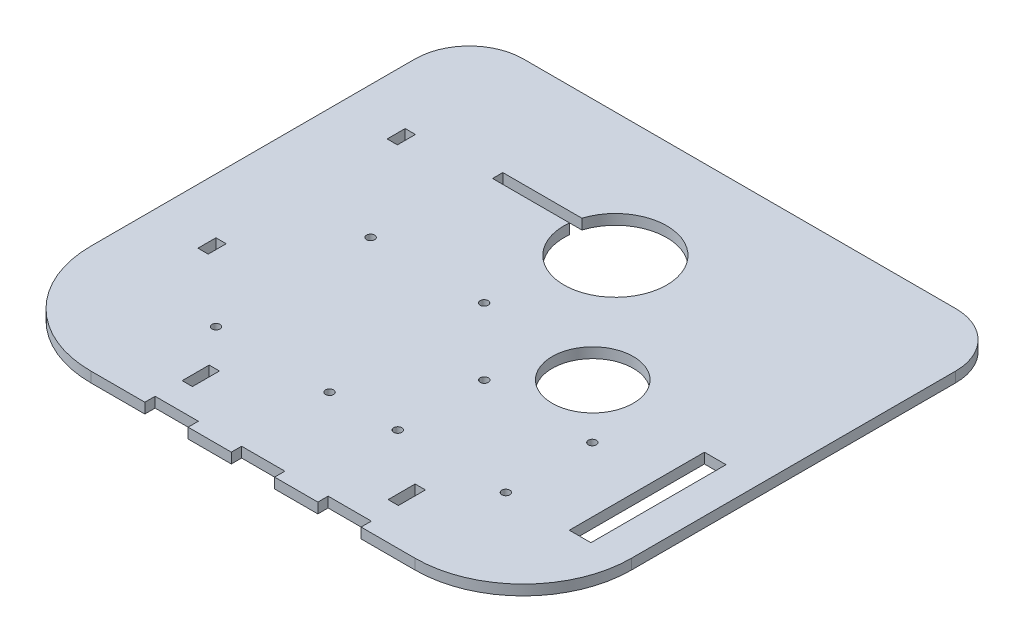
from build123d import *

# Parameters (mm, degrees)
SKETCH1_W           = 254
SKETCH1_H           = 228.6
BOSS_EXTRUDE1_DEPTH = 4.826
CUT_EXTRUDE3_DEPTH  = 4.826
SKETCH19_W          = 4.826
SKETCH19_H          = 8.466666666
CUT_EXTRUDE16_DEPTH = 171.929167423
FILLET11_R          = 50.8
SKETCH20_W          = 10.16
SKETCH20_H          = 63.5
CUT_EXTRUDE17_DEPTH = 171.929167423
SKETCH23_R          = 1.905
CUT_EXTRUDE18_DEPTH = 171.929167423
SKETCH24_W          = 20.32
SKETCH24_H          = 4.826
CUT_EXTRUDE19_DEPTH = 171.929167423
SKETCH26_R          = 24.13
CUT_EXTRUDE20_DEPTH = 171.929167423
SKETCH27_W          = 4.826
SKETCH27_H          = 12.7
CUT_EXTRUDE21_DEPTH = 171.929167423
SKETCH28_R          = 19.05
CUT_EXTRUDE22_DEPTH = 171.929167423
CUT_EXTRUDE23_DEPTH = 171.929167423


with BuildPart() as part:
    # Sketch1 → Boss-Extrude1 (new body)
    with BuildSketch(Plane(origin=(0, 0, 0), x_dir=(1, 0, 0), z_dir=(0, 1, 0))):
        Rectangle(SKETCH1_W, SKETCH1_H)
    extrude(amount=BOSS_EXTRUDE1_DEPTH)

    # Sketch4 → Cut-Extrude3 (cut)
    with BuildSketch(Plane(origin=(0, 4.826, 0), x_dir=(1, 0, 0), z_dir=(0, 1, 0))):
        with BuildLine():
            Line((-127, 88.9), (-127, 114.3))
            Line((-127, 114.3), (-101.6, 114.3))
            ThreePointArc((-101.6, 114.3), (-119.560512242, 106.860512242), (-127, 88.9))
        make_face()
        with BuildLine():
            Line((127, 88.9), (127, 114.3))
            Line((127, 114.3), (101.6, 114.3))
            ThreePointArc((101.6, 114.3), (119.560512242, 106.860512242), (127, 88.9))
        make_face()
    extrude(amount=-CUT_EXTRUDE3_DEPTH, mode=Mode.SUBTRACT)

    # Sketch19 → Cut-Extrude16 (cut, through all)
    with BuildSketch(Plane(origin=(0, 4.826, 0), x_dir=(1, 0, 0), z_dir=(0, 1, 0))):
        with Locations((-98.58699993, -34.925)):
            Rectangle(SKETCH19_W, SKETCH19_H)
        with Locations((-98.58699993, 53.975)):
            Rectangle(SKETCH19_W, SKETCH19_H)
    extrude(amount=-CUT_EXTRUDE16_DEPTH, mode=Mode.SUBTRACT)

    # Fillet11
    fillet11_edges = [part.edges().sort_by_distance(p)[0] for p in [
        (-127, 2.413, 114.3),
        (127, 2.413, 114.3),
    ]]
    fillet(fillet11_edges, radius=FILLET11_R)

    # Sketch20 → Cut-Extrude17 (cut, through all)
    with BuildSketch(Plane.XZ):
        with Locations((106.07999993, 34.925)):
            Rectangle(SKETCH20_W, SKETCH20_H)
    extrude(amount=-CUT_EXTRUDE17_DEPTH, mode=Mode.SUBTRACT)

    # Sketch23 → Cut-Extrude18 (cut, through all)
    with BuildSketch(Plane(origin=(0, 4.826, 0), x_dir=(1, 0, 0), z_dir=(0, 1, 0))):
        with Locations((70.741119647, -25.576370111)):
            Circle(SKETCH23_R)
        with Locations((70.741119647, -66.216370111)):
            Circle(SKETCH23_R)
        with Locations((19.941119647, -25.576370111)):
            Circle(SKETCH23_R)
        with Locations((19.941119647, -66.216370111)):
            Circle(SKETCH23_R)
        with Locations((-11.48044922, 5.792629889)):
            Circle(SKETCH23_R)
        with Locations((-64.82044922, 5.792629889)):
            Circle(SKETCH23_R)
        with Locations((-64.82044922, -66.851370111)):
            Circle(SKETCH23_R)
        with Locations((-11.48044922, -66.851370111)):
            Circle(SKETCH23_R)
    extrude(amount=-CUT_EXTRUDE18_DEPTH, mode=Mode.SUBTRACT)

    # Sketch24 → Cut-Extrude19 (cut, through all)
    with BuildSketch(Plane.XZ):
        with Locations((-40.64, 111.887)):
            Rectangle(SKETCH24_W, SKETCH24_H)
        with Locations((0, 111.887)):
            Rectangle(SKETCH24_W, SKETCH24_H)
        with Locations((40.64, 111.887)):
            Rectangle(SKETCH24_W, SKETCH24_H)
    extrude(amount=-CUT_EXTRUDE19_DEPTH, mode=Mode.SUBTRACT)

    # Sketch26 → Cut-Extrude20 (cut, through all)
    with BuildSketch(Plane.XZ):
        with Locations((0, -55.982011538)):
            Circle(SKETCH26_R)
    extrude(amount=-CUT_EXTRUDE20_DEPTH, mode=Mode.SUBTRACT)

    # Sketch27 → Cut-Extrude21 (cut, through all)
    with BuildSketch(Plane.XZ):
        with Locations((-48.387, 90.424)):
            Rectangle(SKETCH27_W, SKETCH27_H)
        with Locations((48.387, 90.424)):
            Rectangle(SKETCH27_W, SKETCH27_H)
    extrude(amount=-CUT_EXTRUDE21_DEPTH, mode=Mode.SUBTRACT)

    # Sketch28 → Cut-Extrude22 (cut, through all)
    with BuildSketch(Plane(origin=(0, 4.826, 0), x_dir=(1, 0, 0), z_dir=(0, 1, 0))):
        with Locations((45.341119647, 0)):
            Circle(SKETCH28_R)
    extrude(amount=-CUT_EXTRUDE22_DEPTH, mode=Mode.SUBTRACT)

    # Sketch29 → Cut-Extrude23 (cut, through all)
    with BuildSketch(Plane(origin=(0, 4.826, 0), x_dir=(1, 0, 0), z_dir=(0, 1, 0))):
        with BuildLine():
            Line((-60.152706323, 58.42), (-24.006522286, 58.42))
            ThreePointArc((-24.006522286, 58.42), (-23.632115547, 60.858487188), (-23.010679512, 63.246))
            Line((-23.010679512, 63.246), (-60.152706323, 63.246))
            Line((-60.152706323, 63.246), (-60.152706323, 58.42))
        make_face()
    extrude(amount=-CUT_EXTRUDE23_DEPTH, mode=Mode.SUBTRACT)


solid = part.part
